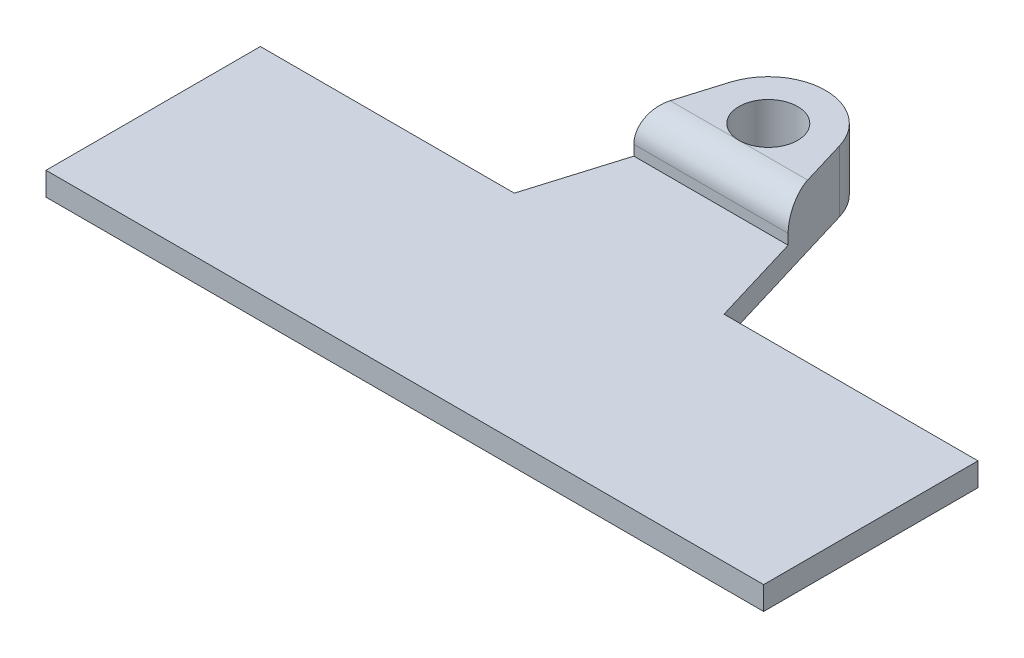
from build123d import *

# Parameters (mm, degrees)
SKETCH_1_R               = 3.15
SKETCH_1_W               = 77
SKETCH_1_H               = 23
EXTRUDE_1_DEPTH          = 6.6
CUT_EXTRUDE_1_DEPTH      = 46.330012133
CUT_EXTRUDE_1_DEPTH_BACK = 46.330012133
FILLET_1_R               = 3


with BuildPart() as part:
    # 草图1 → 凸台-拉伸1 (new body)
    # profile 1 of 2: a face of its own
    with BuildSketch(Plane(origin=(0, 0, 0), x_dir=(1, 0, 0), z_dir=(0, 1, 0))):
        with BuildLine():
            Line((-5.888001359, 17.775933557), (-11.249562098, 0))
            Line((-11.249562098, 0), (11.249562098, 0))
            Line((11.249562098, 0), (5.888001359, 17.775933557))
            ThreePointArc((5.888001359, 17.775933557), (0, 22.15), (-5.888001359, 17.775933557))
        make_face()
        with Locations(Location((0, 16, 0), (0, 0, 270))):
            Circle(SKETCH_1_R, mode=Mode.SUBTRACT)
    # profile 2 of 2: a face of its own
    with BuildSketch(Plane(origin=(0, 0, 0), x_dir=(1, 0, 0), z_dir=(0, 1, 0))):
        with Locations((0, -11.5)):
            Rectangle(SKETCH_1_W, SKETCH_1_H)
    extrude(amount=EXTRUDE_1_DEPTH)

    # 草图2 → 切除-拉伸1 (cut, two sides: drawn at the far end of the back side and taken through both)
    with BuildSketch(Plane(origin=(0, 0, 0), x_dir=(0, 0, -1), z_dir=(1, 0, 0)).offset(-CUT_EXTRUDE_1_DEPTH_BACK)):
        Polygon((-123.671550114, 2.5), (-23, 2.5), (9.85, 2.5), (9.85, 6.6), (9.85, 107.271550114), (-114.442682903, 265.67095979), (-247.964233016, 160.899409677), align=None)
    extrude(amount=CUT_EXTRUDE_1_DEPTH + CUT_EXTRUDE_1_DEPTH_BACK, mode=Mode.SUBTRACT)

    # 圆角1
    fillet_1_edges = [part.edges().sort_by_distance(p)[0] for p in [
        (0, 6.6, -9.85),
    ]]
    fillet(fillet_1_edges, radius=FILLET_1_R - 0.0001)  # a hair under: the kernel refuses the full size


solid = part.part
